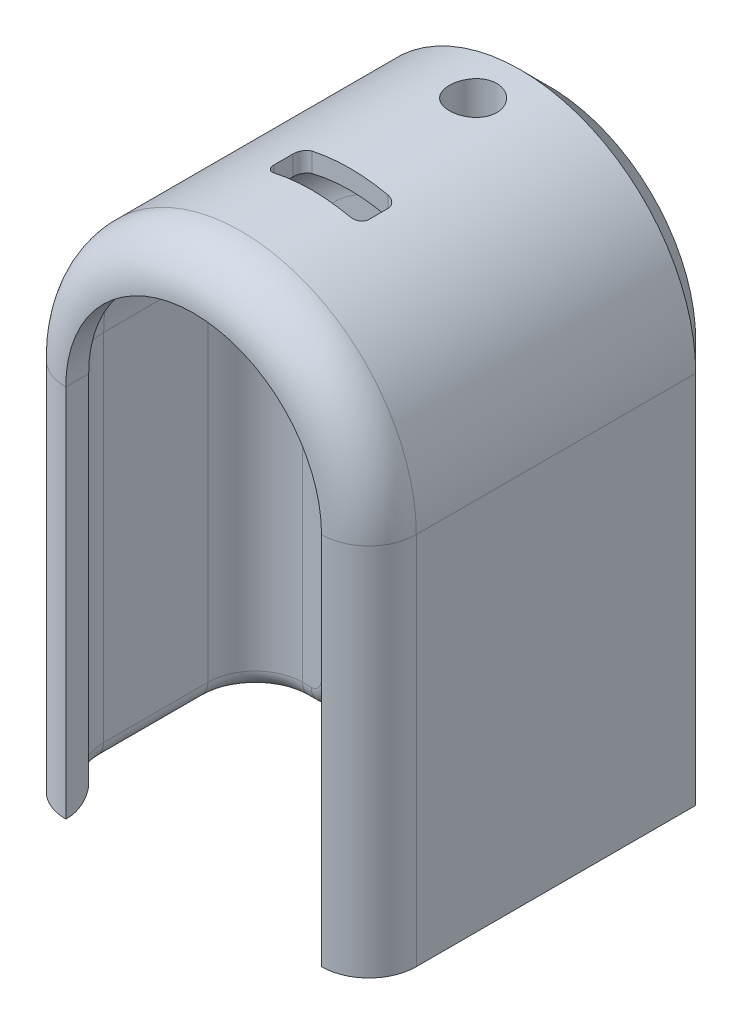
from build123d import *

# Parameters (mm, degrees)
BOSS_EXTRU_1_DEPTH       = 21
COQUE2_T                 = 2
CONG_1_R                 = 5
ENL_V_MAT_EXTRU_1_DEPTH  = 10
CONG_3_R                 = 5
ESQUISSE3_R              = 5
ENL_V_MAT_EXTRU_2_DEPTH  = 10
ESQUISSE4_W              = 10
ESQUISSE4_H              = 4
ENL_V_MAT_EXTRU_4_DEPTH  = 72.54019849
CONG_5_R                 = 1
ESQUISSE6_R              = 8
ENL_V_MAT_EXTRU_6_DEPTH  = 10
CONG_7_R                 = 3
CONG_8_R                 = 2
BOSS_EXTRU_4_DEPTH       = 12.5
ESQUISSE16_R             = 1
ENL_V_MAT_EXTRU_7_DEPTH  = 9
ESQUISSE17_R             = 1.5
ENL_V_MAT_EXTRU_8_DEPTH  = 2
ESQUISSE18_W             = 8
ESQUISSE18_H             = 31
ENL_V_MAT_EXTRU_9_DEPTH  = 14
CHANFREIN1_SIZE          = 3
ESQUISSE22_R             = 5.25
ENL_V_MAT_EXTRU_11_DEPTH = 10.5
ESQUISSE28_W             = 6.911559072
ESQUISSE28_H             = 5.889675852
ENL_V_MAT_EXTRU_15_DEPTH = 10
ESQUISSE29_R             = 2.5
ENL_V_MAT_EXTRU_16_DEPTH = 28


# Some blends are built 0.0001 mm under size
with BuildPart() as part:
    # Esquisse1 → Boss.-Extru.1 (new body)
    with BuildSketch(Plane.XY):
        with BuildLine():
            ThreePointArc((33, 39.5), (16.5, 56), (0, 39.5))
            Line((0, 39.5), (33, 39.5))
        make_face()
        with BuildLine():
            Line((33, 39.5), (0, 39.5))
            ThreePointArc((0, 39.5), (16.5, 23), (33, 39.5))
        make_face()
        with BuildLine():
            Line((0, 39.5), (0, 0))
            Line((0, 0), (33, 0))
            Line((33, 0), (33, 39.5))
            ThreePointArc((33, 39.5), (16.5, 23), (0, 39.5))
        make_face()
    extrude(amount=BOSS_EXTRU_1_DEPTH)

    # Coque2
    coque2_openings = [part.faces().sort_by_distance(p)[0] for p in [
        (16.5, 0, 10.5),
    ]]
    offset(amount=COQUE2_T, openings=coque2_openings, kind=Kind.INTERSECTION)

    # Congé1
    # the kernel refuses this fillet: 5 mm, written as the material it adds along each edge
    with BuildSketch(Plane(origin=(16.5, 39.5, 0), x_dir=(1, 0, 0), z_dir=(0, -1, 0))) as cong_1_piece_1:
        with BuildLine():
            CenterArc((16.5 - CONG_1_R, CONG_1_R), CONG_1_R, 270, 90)
            Line((16.5 - CONG_1_R, 0), (16.5, 0))
            Line((16.5, 0), (16.5, CONG_1_R))
        make_face()
    revolve(axis=Axis((16.5, 39.5, 0), (0, 0, 1)), revolution_arc=180)
    with BuildSketch(Plane(origin=(0, 39.5, 21), x_dir=(0, 0, -1), z_dir=(0, -1, 0)), Plane(origin=(33, 0, 0), x_dir=(-1, 0, 0), z_dir=(0, 1, 0)), Plane(origin=(0, 39.5, 0), x_dir=(1, 0, 0), z_dir=(0, -1, 0))) as cong_1_piece_2:
        with BuildLine():
            CenterArc((CONG_1_R, CONG_1_R), CONG_1_R, 180, 90)
            Line((0, CONG_1_R), (0, 0))
            Line((0, 0), (CONG_1_R, 0))
        make_face()
    extrude(amount=39.5)
    with BuildSketch(Plane(origin=(16.5, 39.5, 21), x_dir=(-1, 0, 0), z_dir=(0, -1, 0))) as cong_1_piece_3:
        with BuildLine():
            CenterArc((16.5 - CONG_1_R, CONG_1_R), CONG_1_R, 270, 90)
            Line((16.5 - CONG_1_R, 0), (16.5, 0))
            Line((16.5, 0), (16.5, CONG_1_R))
        make_face()
    revolve(axis=Axis((16.5, 39.5, 21), (0, 0, -1)), revolution_arc=180)
    with BuildSketch(Plane(origin=(33, 0, 21), x_dir=(-1, 0, 0), z_dir=(0, 1, 0))) as cong_1_piece_4:
        with BuildLine():
            CenterArc((CONG_1_R, -CONG_1_R), CONG_1_R, 90, 90)
            Line((0, -CONG_1_R), (0, 0))
            Line((0, 0), (CONG_1_R, 0))
        make_face()
    extrude(amount=39.5)

    # Esquisse2 → Enlèv. mat.-Extru.1 (cut)
    with BuildSketch(Plane.XY.offset(23)):
        with BuildLine():
            Line((3, 0), (30, 0))
            Line((30, 0), (30, 39.5))
            ThreePointArc((30, 39.5), (16.5, 53), (3, 39.5))
            Line((3, 39.5), (3, 0))
        make_face()
    extrude(amount=-ENL_V_MAT_EXTRU_1_DEPTH, mode=Mode.SUBTRACT)

    # Congé3
    cong_3_edges = [part.edges().sort_by_distance(p)[0] for p in [
        (35, 19.75, 23),
        (16.5, 58, 23),
        (-2, 19.75, 23),
    ]]
    fillet(cong_3_edges, radius=CONG_3_R - 0.0001)  # a hair under: the kernel refuses the full size

    # Esquisse3 → Enlèv. mat.-Extru.2 (cut)
    # profile 1 of 3: a face of its own
    with BuildSketch(Plane(origin=(0, 0, -2), x_dir=(-1, 0, 0), z_dir=(0, 0, -1))):
        with BuildLine():
            Line((-21.502659733, 15), (-21.502659733, 14))
            ThreePointArc((-21.502659733, 14), (-16.5, 8.997340267), (-11.497340267, 14))
            Line((-11.497340267, 14), (-11.497340267, 15))
            ThreePointArc((-11.497340267, 15), (-16.5, 20.002659733), (-21.502659733, 15))
        make_face()
        with Locations((-16.5, 15)):
            Circle(ESQUISSE3_R, mode=Mode.SUBTRACT)
    # profile 2 of 3: a face of its own
    with BuildSketch(Plane(origin=(0, 0, -2), x_dir=(-1, 0, 0), z_dir=(0, 0, -1))):
        with Locations((-16.5, 26.5)):
            Circle(ESQUISSE3_R)
    # profile 3 of 3: a face of its own
    with BuildSketch(Plane(origin=(0, 0, -2), x_dir=(-1, 0, 0), z_dir=(0, 0, -1))):
        with BuildLine():
            Line((-21.5, 27.5), (-21.5, 26.5))
            ThreePointArc((-21.5, 26.5), (-16.5, 31.5), (-11.5, 26.5))
            Line((-11.5, 26.5), (-11.5, 27.5))
            ThreePointArc((-11.5, 27.5), (-16.5, 32.5), (-21.5, 27.5))
        make_face()
    extrude(amount=-ENL_V_MAT_EXTRU_2_DEPTH, mode=Mode.SUBTRACT)


with BuildPart() as enl_v_mat_extru_2_kept_piece:
    # of the separate pieces the step leaves, the one the design keeps (enl_v_mat_extru_2_pieces_kept)
    add(part.part.solids().sort_by_distance((30.0001, 0, 23))[0])

    # Esquisse4 → Enlèv. mat.-Extru.4 (cut, through all)
    with BuildSketch(Plane(origin=(0, 0, 0), x_dir=(-1, 0, 0), z_dir=(0, -1, 0))):
        with Locations((-16.5, -8.5)):
            Rectangle(ESQUISSE4_W, ESQUISSE4_H)
    extrude(amount=-ENL_V_MAT_EXTRU_4_DEPTH, mode=Mode.SUBTRACT)

    # Congé5
    cong_5_edges = [enl_v_mat_extru_2_kept_piece.edges().sort_by_distance(p)[0] for p in [
        (11.5, 56.267849162, 6.5),
        (11.5, 56.267849162, 10.5),
        (21.5, 56.267849162, 10.5),
        (21.5, 56.267849162, 6.5),
    ]]
    fillet(cong_5_edges, radius=CONG_5_R)

    # Esquisse6 → Enlèv. mat.-Extru.6 (cut)
    with BuildSketch(Plane(origin=(0, 0, -2), x_dir=(-1, 0, 0), z_dir=(0, 0, -1))):
        with Locations((-16.5, 0)):
            Circle(ESQUISSE6_R)
    extrude(amount=-ENL_V_MAT_EXTRU_6_DEPTH, mode=Mode.SUBTRACT)

    # Congé7
    cong_7_edges = [enl_v_mat_extru_2_kept_piece.edges().sort_by_distance(p)[0] for p in [
        (24.5, 0, -1),
        (8.5, 0, -1),
    ]]
    fillet(cong_7_edges, radius=CONG_7_R)

    # Congé8
    # the kernel refuses this fillet: 2 mm, written as the material it takes off along each edge
    with BuildSketch(Plane(origin=(5, 0, 16), x_dir=(0.5552819318749749, 0, 0.8316621766878639), z_dir=(0.8316621766878639, 0, -0.5552819318749749))) as cong_8_piece_1:
        with BuildLine():
            CenterArc((5 + CONG_8_R, -CONG_8_R), CONG_8_R, 90, 90)
            Line((5, -CONG_8_R), (5, 0))
            Line((5, 0), (5 + CONG_8_R, 0))
        make_face()
    revolve(axis=Axis((5, 0, 16), (0, -1, 0)), revolution_arc=123.730135743, mode=Mode.SUBTRACT)
    with BuildSketch(Plane(origin=(28, 0, 16), x_dir=(-0.5552819318749734, 0, 0.8316621766878649), z_dir=(-0.8316621766878649, 0, -0.5552819318749734))) as cong_8_piece_2:
        with BuildLine():
            CenterArc((5 + CONG_8_R, CONG_8_R), CONG_8_R, 180, 90)
            Line((5, CONG_8_R), (5, 0))
            Line((5, 0), (5 + CONG_8_R, 0))
        make_face()
    revolve(axis=Axis((28, 0, 16), (0, 1, 0)), revolution_arc=123.730135743, mode=Mode.SUBTRACT)
    with BuildSketch(Plane(origin=(33, 0, 5), x_dir=(1, 0, 0), z_dir=(0, 0, 1))) as cong_8_piece_3:
        with BuildLine():
            CenterArc((CONG_8_R, CONG_8_R), CONG_8_R, 180, 90)
            Line((0, CONG_8_R), (0, 0))
            Line((0, 0), (CONG_8_R, 0))
        make_face()
    extrude(amount=11, mode=Mode.SUBTRACT)
    with BuildSketch(Plane(origin=(28, 0, 5), x_dir=(1, 0, 0), z_dir=(0, 0, 1))) as cong_8_piece_4:
        with BuildLine():
            CenterArc((5 + CONG_8_R, CONG_8_R), CONG_8_R, 180, 90)
            Line((5, CONG_8_R), (5, 0))
            Line((5, 0), (5 + CONG_8_R, 0))
        make_face()
    revolve(axis=Axis((28, 0, 5), (0, 1, 0)), revolution_arc=90, mode=Mode.SUBTRACT)
    with BuildSketch(Plane(origin=(27.083005244, 3, 0), x_dir=(0, -1, 0), z_dir=(1, 0, 0))) as cong_8_piece_5:
        with BuildLine():
            CenterArc((3 - CONG_8_R, CONG_8_R), CONG_8_R, 270, 90)
            Line((3 - CONG_8_R, 0), (3, 0))
            Line((3, 0), (3, CONG_8_R))
        make_face()
    revolve(axis=Axis((27.083005244, 3, 0), (0, 0, -1)), revolution_arc=74.173379868, mode=Mode.SUBTRACT)
    with BuildSketch(Plane(origin=(16.5, 0, 0), x_dir=(-0.9620913858416693, 0.27272727272727265, 0), z_dir=(-0.27272727272727265, -0.9620913858416693, 0))) as cong_8_piece_6:
        with BuildLine():
            CenterArc((8 + CONG_8_R, CONG_8_R), CONG_8_R, 180, 90)
            Line((8 + CONG_8_R, 0), (8, 0))
            Line((8, 0), (8, CONG_8_R))
        make_face()
    revolve(axis=Axis((16.5, 0, 0), (0, 0, -1)), revolution_arc=148.346759736, mode=Mode.SUBTRACT)
    with BuildSketch(Plane(origin=(5.916994756, 3, 0), x_dir=(0.9620913858416693, -0.27272727272727276, 0), z_dir=(0.27272727272727276, 0.9620913858416693, 0))) as cong_8_piece_7:
        with BuildLine():
            CenterArc((3 - CONG_8_R, CONG_8_R), CONG_8_R, 270, 90)
            Line((3 - CONG_8_R, 0), (3, 0))
            Line((3, 0), (3, CONG_8_R))
        make_face()
    revolve(axis=Axis((5.916994756, 3, 0), (0, 0, -1)), revolution_arc=74.173379868, mode=Mode.SUBTRACT)
    with BuildSketch(Plane(origin=(5, 0, 5), x_dir=(-1, 0, 0), z_dir=(0, 0, 1))) as cong_8_piece_8:
        with BuildLine():
            CenterArc((5 + CONG_8_R, -CONG_8_R), CONG_8_R, 90, 90)
            Line((5, -CONG_8_R), (5, 0))
            Line((5, 0), (5 + CONG_8_R, 0))
        make_face()
    revolve(axis=Axis((5, 0, 5), (0, -1, 0)), revolution_arc=90, mode=Mode.SUBTRACT)
    with BuildSketch(Plane(origin=(0, 0, 5), x_dir=(-1, 0, 0), z_dir=(0, 0, 1))) as cong_8_piece_9:
        with BuildLine():
            CenterArc((CONG_8_R, -CONG_8_R), CONG_8_R, 90, 90)
            Line((0, -CONG_8_R), (0, 0))
            Line((0, 0), (CONG_8_R, 0))
        make_face()
    extrude(amount=11, mode=Mode.SUBTRACT)
    with BuildSketch(Plane(origin=(27.083005244, 0, 0), x_dir=(0, 0, -1), z_dir=(1, 0, 0)), Plane(origin=(5, 0, 0), x_dir=(0, 0, -1), z_dir=(1, 0, 0))) as cong_8_piece_10:
        with BuildLine():
            CenterArc((CONG_8_R, CONG_8_R), CONG_8_R, 180, 90)
            Line((0, CONG_8_R), (0, 0))
            Line((0, 0), (CONG_8_R, 0))
        make_face()
    extrude(amount=0.916994756, mode=Mode.SUBTRACT)

    # Esquisse15 → Boss.-Extru.4 (add)
    with BuildSketch(Plane(origin=(0, 0, -2), x_dir=(-1, 0, 0), z_dir=(0, 0, -1))):
        with BuildLine():
            Line((2, 0), (2, 14.2))
            Line((2, 14.2), (-1.4, 14.2))
            Line((-1.4, 14.2), (-1.4, 9.4))
            Line((-1.4, 9.4), (-4.2, 9.4))
            Line((-4.2, 9.4), (-4.2, 14.2))
            Line((-4.2, 14.2), (-11.497340267, 14.2))
            Line((-11.497340267, 14.2), (-11.497340267, 14))
            ThreePointArc((-11.497340267, 14), (-16.5, 8.997340267), (-21.502659733, 14))
            Line((-21.502659733, 14), (-21.5, 27))
            Line((-21.5, 27), (-21.5, 27.5))
            ThreePointArc((-21.5, 27.5), (-20.035533906, 31.035533906), (-16.5, 32.5))
            Line((-16.5, 32.5), (-8.6, 32.5))
            Line((-8.6, 32.5), (-8.6, 37.1))
            Line((-8.6, 37.1), (-4.2, 37.1))
            Line((-4.2, 37.1), (-4.2, 41.9))
            Line((-4.2, 41.9), (-1.35, 41.9))
            Line((-1.35, 41.9), (-1.35, 37.1))
            Line((-1.35, 37.1), (2, 37.1))
            Line((2, 37.1), (2, 39.5))
            ThreePointArc((2, 39.5), (-16.5, 58), (-35, 39.5))
            Line((-35, 39.5), (-35, 0))
            Line((-35, 0), (-28, 0))
            Line((-28, 0), (-27.083005244, 0))
            ThreePointArc((-27.083005244, 0), (-25.273937177, 0.606827894), (-24.196731087, 2.181818182))
            ThreePointArc((-24.196731087, 2.181818182), (-16.5, 8), (-8.803268913, 2.181818182))
            ThreePointArc((-8.803268913, 2.181818182), (-7.726062823, 0.606827894), (-5.916994756, 0))
            Line((-5.916994756, 0), (-5, 0))
            Line((-5, 0), (2, 0))
        make_face()
    extrude(amount=BOSS_EXTRU_4_DEPTH)

    # Esquisse16 → Enlèv. mat.-Extru.7 (cut)
    with BuildSketch(Plane.ZY.offset(2)):
        with Locations(Location((-8.1, 39.75, 0), (0, 0, 270))):
            Circle(ESQUISSE16_R)
        with Locations(Location((-8.1, 11.763926596, 0), (0, 0, 270))):
            Circle(ESQUISSE16_R)
    extrude(amount=-ENL_V_MAT_EXTRU_7_DEPTH, mode=Mode.SUBTRACT)

    # Esquisse17 → Enlèv. mat.-Extru.8 (cut)
    with BuildSketch(Plane.ZY.offset(2)):
        with Locations(Location((-8.1, 11.763926596, 0), (0, 0, 270))):
            Circle(ESQUISSE17_R)
        with Locations(Location((-8.1, 39.75, 0), (0, 0, 270))):
            Circle(ESQUISSE17_R)
    extrude(amount=-ENL_V_MAT_EXTRU_8_DEPTH, mode=Mode.SUBTRACT)

    # Esquisse18 → Enlèv. mat.-Extru.9 (cut)
    with BuildSketch(Plane(origin=(0, 0, -14.5), x_dir=(-1, 0, 0), z_dir=(0, 0, -1))):
        with Locations((-27.501222835, 25.840985577)):
            Rectangle(ESQUISSE18_W, ESQUISSE18_H)
    extrude(amount=-ENL_V_MAT_EXTRU_9_DEPTH, mode=Mode.SUBTRACT)

    # Chanfrein1
    chanfrein1_edges = [enl_v_mat_extru_2_kept_piece.edges().sort_by_distance(p)[0] for p in [
        (-2, 38.3, -14.5),
        (16.5, 58, -14.5),
        (35, 19.75, -14.5),
        (-2, 7.1, -14.5),
    ]]
    chamfer(chanfrein1_edges, length=CHANFREIN1_SIZE)

    # Esquisse22 → Enlèv. mat.-Extru.11 (cut)
    with BuildSketch(Plane(origin=(0, 0, -14.5), x_dir=(-1, 0, 0), z_dir=(0, 0, -1))):
        with Locations((-16.589663763, 40.5)):
            Circle(ESQUISSE22_R)
    extrude(amount=-ENL_V_MAT_EXTRU_11_DEPTH, mode=Mode.SUBTRACT)

    # Esquisse28 → Enlèv. mat.-Extru.15 (cut)
    with BuildSketch(Plane(origin=(0, 0, -14.5), x_dir=(-1, 0, 0), z_dir=(0, 0, -1))):
        with Locations((-20.045443299, 38.194837926)):
            Rectangle(ESQUISSE28_W, ESQUISSE28_H)
    extrude(amount=-ENL_V_MAT_EXTRU_15_DEPTH, mode=Mode.SUBTRACT)

    # Esquisse29 → Enlèv. mat.-Extru.16 (cut)
    with BuildSketch(Plane(origin=(0, 41.340985577, 0), x_dir=(-1, 0, 0), z_dir=(0, -1, 0))):
        with Locations(Location((-16.5, 6.5, 0), (0, 0, 90))):
            Circle(ESQUISSE29_R)
    extrude(amount=-ENL_V_MAT_EXTRU_16_DEPTH, mode=Mode.SUBTRACT)


solid = enl_v_mat_extru_2_kept_piece.part
